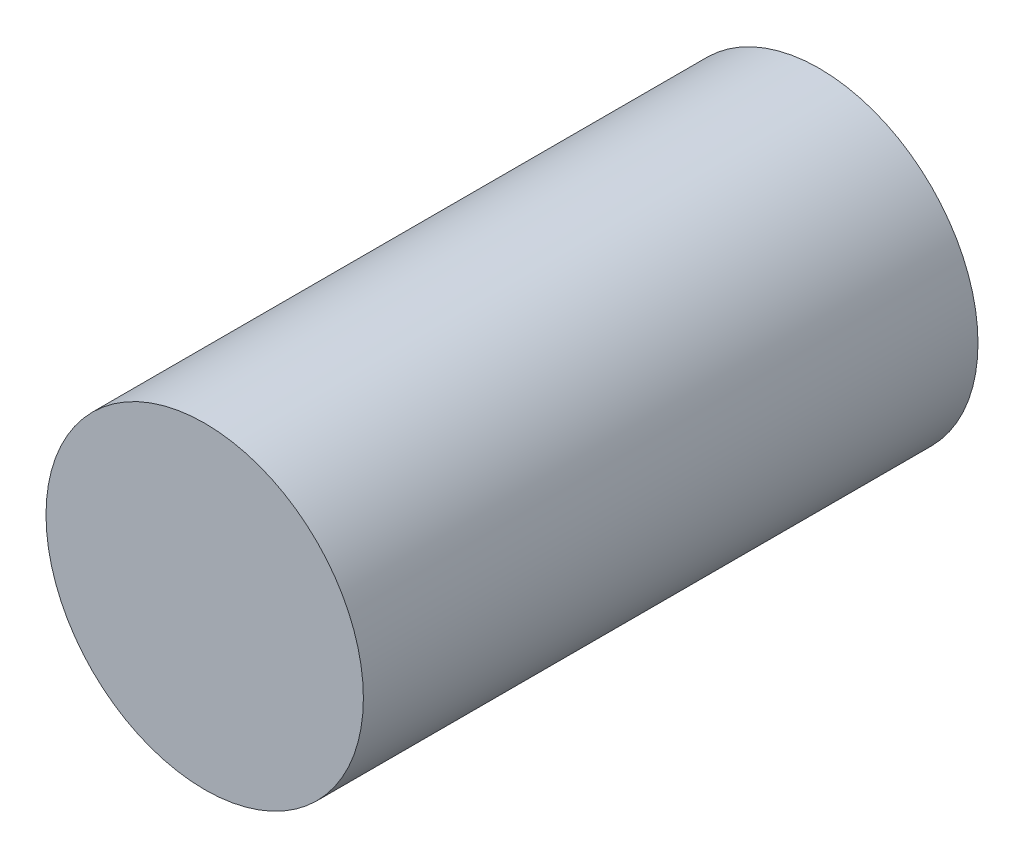
from build123d import *

# Parameters (mm, degrees)
SKETCH1_R           = 31.5
SKETCH1_R_2         = 30
BOSS_EXTRUDE1_DEPTH = 120
SKETCH2_R           = 31.5
BOSS_EXTRUDE2_DEPTH = 2


with BuildPart() as part:
    # Sketch1 → Boss-Extrude1 (new body)
    with BuildSketch(Plane.XY):
        Circle(SKETCH1_R)
        Circle(SKETCH1_R_2, mode=Mode.SUBTRACT)
    extrude(amount=BOSS_EXTRUDE1_DEPTH)

    # Sketch2 → Boss-Extrude2 (add)
    with BuildSketch(Plane.XY.offset(120)):
        Circle(SKETCH2_R)
    extrude(amount=BOSS_EXTRUDE2_DEPTH)


solid = part.part
